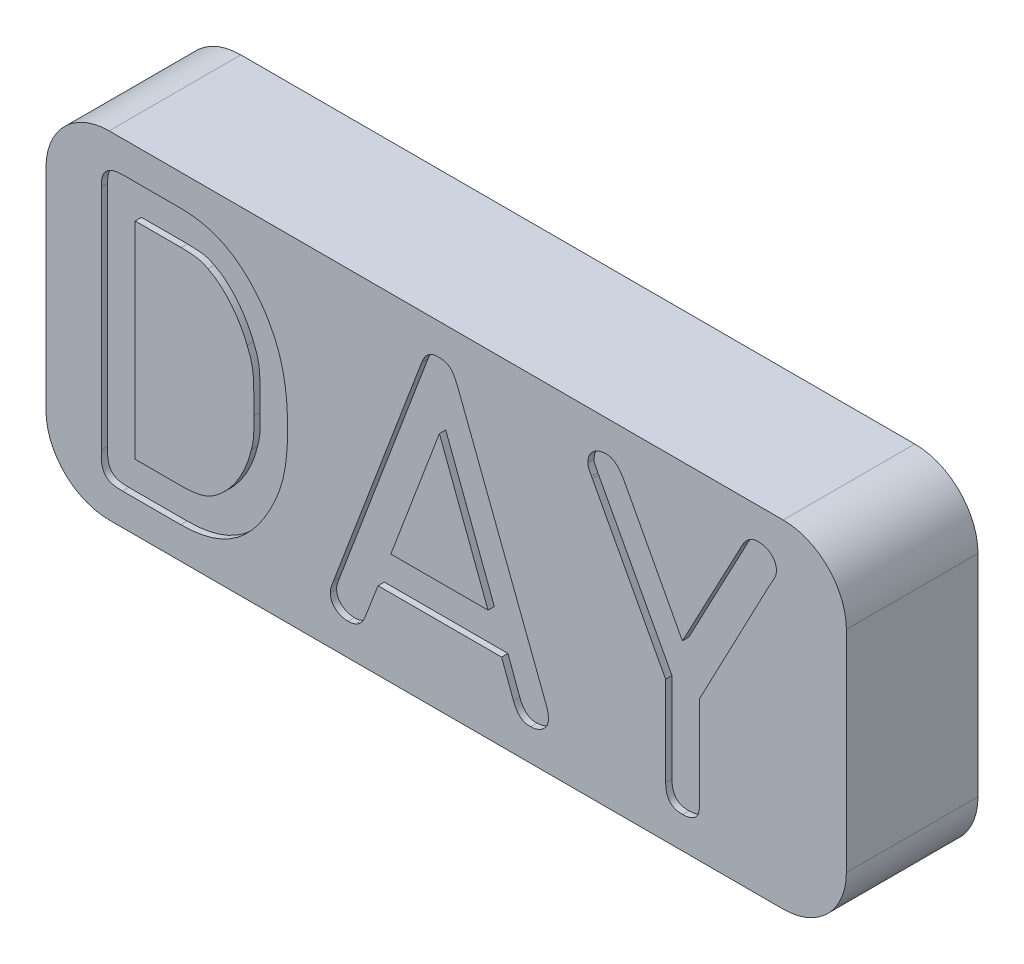
from build123d import *

# Parameters (mm, degrees)
SKETCH1_W           = 9.652
SKETCH1_H           = 4.064
BOSS_EXTRUDE1_DEPTH = 1.5875
WRAP1_START         = -0.0762
WRAP1_DEPTH         = 0.0762
FILLET1_R           = 0.762


# Read off the part's stored shape, not the designer's step: Wrap1
with BuildPart() as part:
    # Sketch1 → Boss-Extrude1 (new body)
    with BuildSketch(Plane.XY):
        Rectangle(SKETCH1_W, SKETCH1_H)
    extrude(amount=BOSS_EXTRUDE1_DEPTH)

    # Wrap1 outline → Wrap1 (cut)
    # profile 1 of 3: a face of its own
    with BuildSketch(Plane.XY.offset(1.5875).offset(WRAP1_START)):
        with BuildLine():
            Line((-4.159063141, 1.397729761), (-4.1583454, -1.349257264))
            add(Edge.make_bspline(
                [(-4.1583454, -1.349257264), (-4.159595144, -1.375481656), (-4.161902506, -1.423898895), (-4.15422181, -1.490454999), (-4.139125833, -1.544437297), (-4.114868878, -1.5875424), (-4.077429232, -1.617599859), (-4.029518678, -1.637564591), (-3.970127313, -1.648565595), (-3.926814308, -1.648966727), (-3.903297641, -1.649184521)],
                knots=[0, 0, 0, 0, 0.167025294, 0.308373349, 0.424684097, 0.522532069, 0.617849996, 0.724418679, 0.850373946, 1, 1, 1, 1], degree=3))
            Line((-3.903297641, -1.649184521), (-3.201776509, -1.649184521))
            add(Edge.make_bspline(
                [(-3.201776509, -1.649184521), (-3.172654346, -1.648815264), (-3.115168501, -1.648086367), (-3.030258456, -1.640962404), (-2.948212559, -1.62790353), (-2.868997757, -1.609951668), (-2.792489904, -1.587103581), (-2.719272698, -1.558337755), (-2.649098411, -1.524123771), (-2.581307122, -1.48550644), (-2.516468648, -1.440739647), (-2.454476016, -1.390053501), (-2.394729739, -1.333850876), (-2.337248805, -1.271833677), (-2.281807249, -1.204355409), (-2.229487442, -1.130617122), (-2.178953724, -1.051576864), (-2.148081353, -0.995818348), (-2.132337088, -0.967382669)],
                knots=[0, 0, 0, 0, 0.065046865, 0.128399597, 0.190141714, 0.250489077, 0.309723565, 0.368336355, 0.42599907, 0.483993368, 0.542459492, 0.601780883, 0.662713469, 0.725549102, 0.790554007, 0.857655962, 0.927407512, 1, 1, 1, 1], degree=3))
            add(Edge.make_bspline(
                [(-2.132337088, -0.967382669), (-2.112533304, -0.93033297), (-2.073491475, -0.857291977), (-2.026920005, -0.744035332), (-1.987376651, -0.631785364), (-1.957409554, -0.517410861), (-1.935792546, -0.397285431), (-1.921102292, -0.267938574), (-1.912404345, -0.127406072), (-1.911990275, -0.030067942), (-1.911775266, 0.020475651)],
                knots=[0, 0, 0, 0, 0.12291401, 0.242316711, 0.358054959, 0.471140303, 0.588028017, 0.715081303, 0.852053716, 1, 1, 1, 1], degree=3))
            add(Edge.make_bspline(
                [(-1.911775266, 0.020475651), (-1.91281257, 0.088787739), (-1.914826893, 0.221441777), (-1.936151973, 0.413388963), (-1.969815341, 0.592336429), (-2.019700255, 0.758234301), (-2.084764538, 0.913400601), (-2.167083252, 1.058328166), (-2.263498947, 1.196328318), (-2.34059189, 1.278624053), (-2.379481279, 1.32013798)],
                knots=[0, 0, 0, 0, 0.144254408, 0.280125091, 0.407420939, 0.528417604, 0.645399546, 0.762053946, 0.879968567, 1, 1, 1, 1], degree=3))
            add(Edge.make_bspline(
                [(-2.379481279, 1.32013798), (-2.407636653, 1.347391992), (-2.463109371, 1.401088814), (-2.555629684, 1.469267242), (-2.652051032, 1.527970941), (-2.753997162, 1.576022118), (-2.861572079, 1.611405484), (-2.973773552, 1.637663562), (-3.091266248, 1.653000746), (-3.171399526, 1.654280998), (-3.212156038, 1.654932145)],
                knots=[0, 0, 0, 0, 0.127203506, 0.250620868, 0.372465497, 0.493612357, 0.615913353, 0.739739727, 0.867629266, 1, 1, 1, 1], degree=3))
            Line((-3.212156038, 1.654932145), (-3.892836025, 1.655649886))
            add(Edge.make_bspline(
                [(-3.892836025, 1.655649886), (-3.914566027, 1.655042754), (-3.955090676, 1.653910504), (-4.011853918, 1.64358906), (-4.05988681, 1.624166881), (-4.099375873, 1.595653788), (-4.128907678, 1.557670192), (-4.148373128, 1.511374362), (-4.159036712, 1.457133886), (-4.159053956, 1.418374609), (-4.159063141, 1.397729761)],
                knots=[0, 0, 0, 0, 0.151334498, 0.282226259, 0.399665048, 0.509458771, 0.617604633, 0.730437121, 0.85641929, 1, 1, 1, 1], degree=3))
        make_face()
        with BuildLine():
            Line((-3.750269406, 1.247573893), (-3.19679021, 1.247573893))
            add(Edge.make_bspline(
                [(-3.19679021, 1.247573893), (-3.178440435, 1.247455325), (-3.1437892, 1.247231426), (-3.094519368, 1.245079234), (-3.050879215, 1.24160904), (-2.99983441, 1.235210081), (-2.93938061, 1.220303308), (-2.895455258, 1.198398591), (-2.873051218, 1.187226133)],
                knots=[0, 0, 0, 0, 0.165198611, 0.311956741, 0.443920568, 0.559186809, 0.775164088, 1, 1, 1, 1], degree=3))
            add(Edge.make_bspline(
                [(-2.873051218, 1.187226133), (-2.848968731, 1.174419259), (-2.799604991, 1.148168015), (-2.731094941, 1.096207152), (-2.664490102, 1.035148784), (-2.600608501, 0.965570889), (-2.541211053, 0.888018733), (-2.487561896, 0.804813184), (-2.439593744, 0.716715362), (-2.413016047, 0.655083557), (-2.399597666, 0.62396728)],
                knots=[0, 0, 0, 0, 0.10881488, 0.2230463, 0.342230135, 0.46952392, 0.599834168, 0.731985659, 0.864686609, 1, 1, 1, 1], degree=3))
            add(Edge.make_bspline(
                [(-2.399597666, 0.62396728), (-2.390745926, 0.602266401), (-2.373513414, 0.560019265), (-2.352203446, 0.496885287), (-2.338121705, 0.435429592), (-2.329656035, 0.384456676), (-2.325957011, 0.34093994), (-2.324062928, 0.301870746), (-2.321710497, 0.256145496), (-2.320363382, 0.203446091), (-2.319892392, 0.143807979), (-2.318935195, 0.077235386), (-2.319026746, 0.003709768), (-2.319567527, -0.047537328), (-2.319850558, -0.074358748)],
                knots=[0, 0, 0, 0, 0.099127311, 0.192980434, 0.28143057, 0.365528, 0.411289482, 0.46607194, 0.530970515, 0.604942006, 0.689021133, 0.783228884, 0.886547541, 1, 1, 1, 1], degree=3))
            add(Edge.make_bspline(
                [(-2.319850558, -0.074358748), (-2.319901356, -0.099743268), (-2.319994326, -0.146201731), (-2.319426137, -0.209436477), (-2.320959599, -0.259741575), (-2.323557376, -0.310664919), (-2.331214798, -0.369410516), (-2.343013033, -0.414536825), (-2.349306697, -0.438609052)],
                knots=[0, 0, 0, 0, 0.207548565, 0.379853035, 0.51696934, 0.618954919, 0.796734903, 1, 1, 1, 1], degree=3))
            add(Edge.make_bspline(
                [(-2.349306697, -0.438609052), (-2.357433064, -0.4708439), (-2.373561165, -0.534819217), (-2.406331463, -0.627670681), (-2.445046243, -0.717093491), (-2.490403726, -0.802080308), (-2.540113578, -0.882974407), (-2.596830942, -0.956714817), (-2.656680865, -1.025858611), (-2.701398566, -1.066468382), (-2.723615195, -1.08664411)],
                knots=[0, 0, 0, 0, 0.131074962, 0.260139653, 0.387904804, 0.515102931, 0.639871402, 0.761924558, 0.881719461, 1, 1, 1, 1], degree=3))
            add(Edge.make_bspline(
                [(-2.723615195, -1.08664411), (-2.739388354, -1.100167755), (-2.770251281, -1.126629118), (-2.820552895, -1.159804826), (-2.872328267, -1.187482632), (-2.927326345, -1.208722431), (-2.986957786, -1.22375982), (-3.052583954, -1.234256853), (-3.125087914, -1.240889744), (-3.175739634, -1.241034106), (-3.202097844, -1.24110923)],
                knots=[0, 0, 0, 0, 0.120601337, 0.235977486, 0.349245628, 0.461120971, 0.577540967, 0.705856495, 0.846933206, 1, 1, 1, 1], degree=3))
            Line((-3.202097844, -1.24110923), (-3.750269406, -1.24110923))
            Line((-3.750269406, -1.24110923), (-3.750269406, 1.247573893))
        make_face(mode=Mode.SUBTRACT)
    # profile 2 of 3: a face of its own
    with BuildSketch(Plane.XY.offset(1.5875).offset(WRAP1_START)):
        with BuildLine():
            Line((0.668221606, -1.097421448), (0.81223423, -1.484560177))
            add(Edge.make_bspline(
                [(0.81223423, -1.484560177), (0.817704383, -1.498432469), (0.828065346, -1.524707839), (0.848909738, -1.559545606), (0.870579593, -1.589708524), (0.896509249, -1.612872575), (0.923885066, -1.631282807), (0.953824523, -1.643919944), (0.986445903, -1.649539044), (1.008677942, -1.649305457), (1.020188229, -1.649184521)],
                knots=[0, 0, 0, 0, 0.155712144, 0.294932837, 0.423707834, 0.542519715, 0.656477865, 0.767676192, 0.879718009, 1, 1, 1, 1], degree=3))
            add(Edge.make_bspline(
                [(1.020188229, -1.649184521), (1.034400005, -1.648552085), (1.062294866, -1.64731074), (1.101995918, -1.635859621), (1.138680773, -1.61941618), (1.170902452, -1.596471446), (1.197824017, -1.568219148), (1.218181852, -1.535836178), (1.231059459, -1.49920525), (1.233185566, -1.473510148), (1.234284069, -1.460234166)],
                knots=[0, 0, 0, 0, 0.134406008, 0.263812006, 0.388740747, 0.514081251, 0.636109856, 0.756416219, 0.874146686, 1, 1, 1, 1], degree=3))
            add(Edge.make_bspline(
                [(1.234284069, -1.460234166), (1.233664401, -1.451602702), (1.232316971, -1.432834097), (1.228031291, -1.403793282), (1.22212411, -1.37472867), (1.216673007, -1.356031787), (1.214167681, -1.347438707)],
                knots=[0, 0, 0, 0, 0.225997365, 0.49141781, 0.766255807, 1, 1, 1, 1], degree=3))
            Line((1.214167681, -1.347438707), (0.141830636, 1.453105955))
            add(Edge.make_bspline(
                [(0.141830636, 1.453105955), (0.134393005, 1.471674367), (0.120618415, 1.506063314), (0.096805239, 1.551796989), (0.072934093, 1.588418439), (0.046756959, 1.615574314), (0.018239561, 1.63574692), (-0.015074484, 1.647329893), (-0.052090636, 1.654942929), (-0.078265313, 1.654935849), (-0.091960629, 1.654932145)],
                knots=[0, 0, 0, 0, 0.178199888, 0.330028559, 0.45911109, 0.566300234, 0.664595433, 0.767289666, 0.878239504, 1, 1, 1, 1], degree=3))
            add(Edge.make_bspline(
                [(-0.091960629, 1.654932145), (-0.103235514, 1.655371795), (-0.125002723, 1.65622058), (-0.156786713, 1.650222335), (-0.18584849, 1.638411519), (-0.213049225, 1.621651473), (-0.237635497, 1.598809889), (-0.260049057, 1.570555334), (-0.279256113, 1.536374599), (-0.289787089, 1.511359217), (-0.295279833, 1.498311699)],
                knots=[0, 0, 0, 0, 0.121600293, 0.234760634, 0.346222357, 0.458938175, 0.577979346, 0.706874815, 0.847111831, 1, 1, 1, 1], degree=3))
            Line((-0.295279833, 1.498311699), (-1.357887035, -1.313035559))
            add(Edge.make_bspline(
                [(-1.357887035, -1.313035559), (-1.361921522, -1.323552392), (-1.369157704, -1.342415194), (-1.37942905, -1.368186143), (-1.385071804, -1.389453813), (-1.392267092, -1.410335568), (-1.397547002, -1.433370189), (-1.397909586, -1.451343568), (-1.39808894, -1.460234166)],
                knots=[0, 0, 0, 0, 0.220157465, 0.394870421, 0.541434731, 0.649467952, 0.826608025, 1, 1, 1, 1], degree=3))
            add(Edge.make_bspline(
                [(-1.39808894, -1.460234166), (-1.39693589, -1.473724929), (-1.394684486, -1.500066508), (-1.382549262, -1.537529883), (-1.36135128, -1.569736514), (-1.334724204, -1.597884539), (-1.302643764, -1.620965084), (-1.265928944, -1.636454022), (-1.226506282, -1.647223314), (-1.198917117, -1.648517929), (-1.184711542, -1.649184521)],
                knots=[0, 0, 0, 0, 0.12798761, 0.24990401, 0.368180291, 0.490096692, 0.615321946, 0.739205204, 0.865717578, 1, 1, 1, 1], degree=3))
            add(Edge.make_bspline(
                [(-1.184711542, -1.649184521), (-1.173179738, -1.649111826), (-1.150867596, -1.648971173), (-1.118682136, -1.64205879), (-1.088907593, -1.631243969), (-1.061456244, -1.616353612), (-1.037045931, -1.596191916), (-1.015697252, -1.571415447), (-0.995765285, -1.542531224), (-0.985838128, -1.520532344), (-0.980673896, -1.50908825)],
                knots=[0, 0, 0, 0, 0.130337654, 0.252181877, 0.37062598, 0.488415777, 0.604093288, 0.72710984, 0.858039109, 1, 1, 1, 1], degree=3))
            Line((-0.980673896, -1.50908825), (-0.821564159, -1.097421448))
            Line((-0.821564159, -1.097421448), (0.668221606, -1.097421448))
        make_face()
        Polygon((-0.081637229, 0.861910637), (0.504345172, -0.689345455), (-0.66761963, -0.689345455), align=None, mode=Mode.SUBTRACT)
    # profile 3 of 3: a face of its own
    with BuildSketch(Plane.XY.offset(1.5875).offset(WRAP1_START)):
        with BuildLine():
            Line((2.848331607, 0.16100411), (2.140213995, 1.494078221))
            add(Edge.make_bspline(
                [(2.140213995, 1.494078221), (2.132488392, 1.507320126), (2.117665565, 1.532726875), (2.093772271, 1.567588888), (2.067315471, 1.595675489), (2.040909025, 1.619444363), (2.012432641, 1.636543083), (1.983464319, 1.649626823), (1.952461854, 1.655218316), (1.931664335, 1.655028452), (1.921115018, 1.654932145)],
                knots=[0, 0, 0, 0, 0.15972807, 0.306464294, 0.438865736, 0.560896868, 0.675131689, 0.783553153, 0.890209667, 1, 1, 1, 1], degree=3))
            add(Edge.make_bspline(
                [(1.921115018, 1.654932145), (1.906907058, 1.654010709), (1.879272083, 1.652218484), (1.839670607, 1.640901636), (1.803100259, 1.623708204), (1.770987038, 1.599294208), (1.744647426, 1.569765885), (1.723235506, 1.536797922), (1.711232984, 1.498836975), (1.708914752, 1.472281484), (1.70773762, 1.458797366)],
                knots=[0, 0, 0, 0, 0.132796021, 0.258292877, 0.382484426, 0.508777843, 0.632443411, 0.751122649, 0.873627203, 1, 1, 1, 1], degree=3))
            add(Edge.make_bspline(
                [(1.70773762, 1.458797366), (1.707622651, 1.450627006), (1.707403558, 1.435057056), (1.71207919, 1.415462818), (1.719141124, 1.398660486), (1.728325893, 1.381673752), (1.738311186, 1.3585383), (1.747332465, 1.342091673), (1.75228105, 1.333069943)],
                knots=[0, 0, 0, 0, 0.180620722, 0.344202152, 0.441826747, 0.584311089, 0.771975584, 1, 1, 1, 1], degree=3))
            Line((1.75228105, 1.333069943), (1.762801601, 1.313662176))
            Line((1.762801601, 1.313662176), (2.646741155, -0.340151571))
            Line((2.646741155, -0.340151571), (2.646741155, -1.417636284))
            add(Edge.make_bspline(
                [(2.646741155, -1.417636284), (2.64719514, -1.43617561), (2.648049461, -1.471063442), (2.656841533, -1.520011032), (2.673792845, -1.561004376), (2.695988705, -1.595593517), (2.726485106, -1.621221805), (2.763270605, -1.638877185), (2.806179107, -1.648936366), (2.836835167, -1.649099072), (2.85293483, -1.649184521)],
                knots=[0, 0, 0, 0, 0.155465801, 0.292559984, 0.414166341, 0.525591441, 0.63387614, 0.743475673, 0.86528095, 1, 1, 1, 1], degree=3))
            add(Edge.make_bspline(
                [(2.85293483, -1.649184521), (2.87249168, -1.648729552), (2.910780139, -1.647838812), (2.963775846, -1.630132841), (3.008408569, -1.602951952), (3.026349371, -1.57567075), (3.034700761, -1.562971432)],
                knots=[0, 0, 0, 0, 0.276331931, 0.541003499, 0.786338495, 1, 1, 1, 1], degree=3))
            add(Edge.make_bspline(
                [(3.034700761, -1.562971432), (3.038056073, -1.55418485), (3.045170048, -1.535555427), (3.051760922, -1.501946353), (3.054954253, -1.457187164), (3.054867837, -1.4228813), (3.054817149, -1.402758773)],
                knots=[0, 0, 0, 0, 0.17324708, 0.367320657, 0.628894138, 1, 1, 1, 1], degree=3))
            Line((3.054817149, -1.402758773), (3.054817149, -0.340151571))
            Line((3.054817149, -0.340151571), (3.91392694, 1.293615949))
            Line((3.91392694, 1.293615949), (3.923858845, 1.308650619))
            add(Edge.make_bspline(
                [(3.923858845, 1.308650619), (3.92991622, 1.318588259), (3.938763192, 1.333102471), (3.946211073, 1.348371693), (3.948559513, 1.353186331)],
                knots=[0, 0, 0, 0, 0.684683451, 1, 1, 1, 1], degree=3))
            add(Edge.make_bspline(
                [(3.948559513, 1.353186331), (3.958977322, 1.37187951), (3.978237558, 1.406439083), (3.981532179, 1.445769679), (3.983044749, 1.463826463)],
                knots=[0, 0, 0, 0, 0.540897266, 1, 1, 1, 1], degree=3))
            add(Edge.make_bspline(
                [(3.983044749, 1.463826463), (3.982273832, 1.477363652), (3.980780037, 1.503594482), (3.967501123, 1.54021756), (3.949005192, 1.573714201), (3.921480579, 1.601360197), (3.889875262, 1.625289046), (3.852871047, 1.641556784), (3.812758449, 1.653206222), (3.784366955, 1.654343383), (3.769667352, 1.654932145)],
                knots=[0, 0, 0, 0, 0.126872492, 0.245839115, 0.362913847, 0.484015425, 0.609722634, 0.733702315, 0.862125241, 1, 1, 1, 1], degree=3))
            add(Edge.make_bspline(
                [(3.769667352, 1.654932145), (3.749464326, 1.654809415), (3.709406337, 1.654566069), (3.652869608, 1.625577465), (3.60280241, 1.578732559), (3.578651123, 1.536751796), (3.565629706, 1.514117432)],
                knots=[0, 0, 0, 0, 0.227391238, 0.450864922, 0.703928116, 1, 1, 1, 1], degree=3))
            Line((3.565629706, 1.514117432), (2.848331607, 0.16100411))
        make_face()
    extrude(amount=WRAP1_DEPTH, mode=Mode.SUBTRACT)

    # Fillet1
    fillet1_edges = [part.edges().sort_by_distance(p)[0] for p in [
        (-4.826, 2.032, 0.79375),
        (4.826, 2.032, 0.79375),
        (4.826, -2.032, 0.79375),
        (-4.826, -2.032, 0.79375),
    ]]
    fillet(fillet1_edges, radius=FILLET1_R)


solid = part.part
